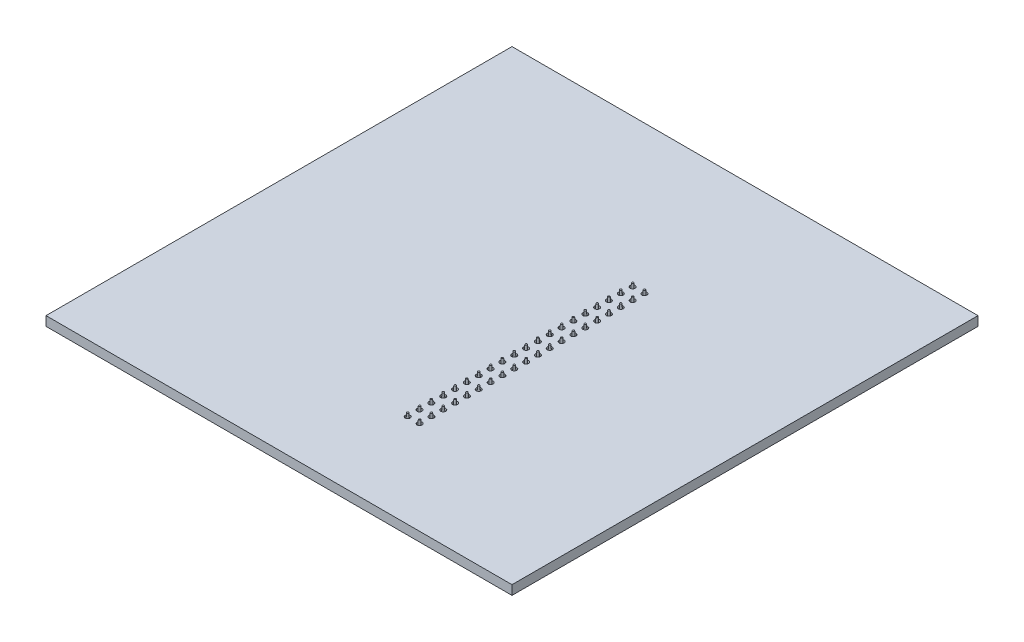
from build123d import *

# Parameters (mm, degrees)
SKETCH1_W              = 100
SKETCH1_H              = 100
BOSS_EXTRUDE1_DEPTH    = 2
SKETCH2_R              = 0.535
CUT_EXTRUDE1_DEPTH     = 71.738956735
SKETCH4_W              = 2.54
SKETCH4_H              = 2.54
SKETCH4_W_2            = 1.54
SKETCH4_H_2            = 1.54
BOSS_EXTRUDE2_DEPTH    = 8.4
LPATTERN2_COUNT        = 20
LPATTERN2_PITCH        = 2.54
LPATTERN2_COUNT_DIR2   = 2
LPATTERN2_PITCH_DIR2   = 2.54
SKETCH5_R              = 0.535
BOSS_EXTRUDE3_DEPTH    = 7.75
BOSS_EXTRUDE3_TAPER    = 2.5
BOSS_EXTRUDE3_2_DEPTH  = 7.75
BOSS_EXTRUDE3_2_TAPER  = 2.5
BOSS_EXTRUDE3_3_DEPTH  = 7.75
BOSS_EXTRUDE3_3_TAPER  = 2.5
BOSS_EXTRUDE3_4_DEPTH  = 7.75
BOSS_EXTRUDE3_4_TAPER  = 2.5
BOSS_EXTRUDE3_5_DEPTH  = 7.75
BOSS_EXTRUDE3_5_TAPER  = 2.5
BOSS_EXTRUDE3_6_DEPTH  = 7.75
BOSS_EXTRUDE3_6_TAPER  = 2.5
BOSS_EXTRUDE3_7_DEPTH  = 7.75
BOSS_EXTRUDE3_7_TAPER  = 2.5
BOSS_EXTRUDE3_8_DEPTH  = 7.75
BOSS_EXTRUDE3_8_TAPER  = 2.5
BOSS_EXTRUDE3_9_DEPTH  = 7.75
BOSS_EXTRUDE3_9_TAPER  = 2.5
BOSS_EXTRUDE3_10_DEPTH = 7.75
BOSS_EXTRUDE3_10_TAPER = 2.5
BOSS_EXTRUDE3_11_DEPTH = 7.75
BOSS_EXTRUDE3_11_TAPER = 2.5
BOSS_EXTRUDE3_12_DEPTH = 7.75
BOSS_EXTRUDE3_12_TAPER = 2.5
BOSS_EXTRUDE3_13_DEPTH = 7.75
BOSS_EXTRUDE3_13_TAPER = 2.5
BOSS_EXTRUDE3_14_DEPTH = 7.75
BOSS_EXTRUDE3_14_TAPER = 2.5
BOSS_EXTRUDE3_15_DEPTH = 7.75
BOSS_EXTRUDE3_15_TAPER = 2.5
BOSS_EXTRUDE3_16_DEPTH = 7.75
BOSS_EXTRUDE3_16_TAPER = 2.5
BOSS_EXTRUDE3_17_DEPTH = 7.75
BOSS_EXTRUDE3_17_TAPER = 2.5
BOSS_EXTRUDE3_18_DEPTH = 7.75
BOSS_EXTRUDE3_18_TAPER = 2.5
BOSS_EXTRUDE3_19_DEPTH = 7.75
BOSS_EXTRUDE3_19_TAPER = 2.5
BOSS_EXTRUDE3_20_DEPTH = 7.75
BOSS_EXTRUDE3_20_TAPER = 2.5
BOSS_EXTRUDE3_21_DEPTH = 7.75
BOSS_EXTRUDE3_21_TAPER = 2.5
BOSS_EXTRUDE3_22_DEPTH = 7.75
BOSS_EXTRUDE3_22_TAPER = 2.5
BOSS_EXTRUDE3_23_DEPTH = 7.75
BOSS_EXTRUDE3_23_TAPER = 2.5
BOSS_EXTRUDE3_24_DEPTH = 7.75
BOSS_EXTRUDE3_24_TAPER = 2.5
BOSS_EXTRUDE3_25_DEPTH = 7.75
BOSS_EXTRUDE3_25_TAPER = 2.5
BOSS_EXTRUDE3_26_DEPTH = 7.75
BOSS_EXTRUDE3_26_TAPER = 2.5
BOSS_EXTRUDE3_27_DEPTH = 7.75
BOSS_EXTRUDE3_27_TAPER = 2.5
BOSS_EXTRUDE3_28_DEPTH = 7.75
BOSS_EXTRUDE3_28_TAPER = 2.5
BOSS_EXTRUDE3_29_DEPTH = 7.75
BOSS_EXTRUDE3_29_TAPER = 2.5
BOSS_EXTRUDE3_30_DEPTH = 7.75
BOSS_EXTRUDE3_30_TAPER = 2.5
BOSS_EXTRUDE3_31_DEPTH = 7.75
BOSS_EXTRUDE3_31_TAPER = 2.5
BOSS_EXTRUDE3_32_DEPTH = 7.75
BOSS_EXTRUDE3_32_TAPER = 2.5
BOSS_EXTRUDE3_33_DEPTH = 7.75
BOSS_EXTRUDE3_33_TAPER = 2.5
BOSS_EXTRUDE3_34_DEPTH = 7.75
BOSS_EXTRUDE3_34_TAPER = 2.5
BOSS_EXTRUDE3_35_DEPTH = 7.75
BOSS_EXTRUDE3_35_TAPER = 2.5
BOSS_EXTRUDE3_36_DEPTH = 7.75
BOSS_EXTRUDE3_36_TAPER = 2.5
BOSS_EXTRUDE3_37_DEPTH = 7.75
BOSS_EXTRUDE3_37_TAPER = 2.5
BOSS_EXTRUDE3_38_DEPTH = 7.75
BOSS_EXTRUDE3_38_TAPER = 2.5
BOSS_EXTRUDE3_39_DEPTH = 7.75
BOSS_EXTRUDE3_39_TAPER = 2.5
BOSS_EXTRUDE3_40_DEPTH = 7.75
BOSS_EXTRUDE3_40_TAPER = 2.5


with BuildPart() as part:
    # Sketch1 → Boss-Extrude1 (new body)
    with BuildSketch(Plane(origin=(0, 0, 0), x_dir=(1, 0, 0), z_dir=(0, 1, 0))):
        Rectangle(SKETCH1_W, SKETCH1_H)
    extrude(amount=BOSS_EXTRUDE1_DEPTH)

    # Sketch2 → Cut-Extrude1 (cut, through all)
    with BuildSketch(Plane(origin=(0, 2, 0), x_dir=(1, 0, 0), z_dir=(0, 1, 0))):
        with Locations((10.138, -29.974)):
            Circle(SKETCH2_R)
        with Locations((7.598, -29.974)):
            Circle(SKETCH2_R)
        with Locations((7.598, -27.434)):
            Circle(SKETCH2_R)
        with Locations((7.598, -24.894)):
            Circle(SKETCH2_R)
        with Locations((7.598, -22.354)):
            Circle(SKETCH2_R)
        with Locations((7.598, -19.814)):
            Circle(SKETCH2_R)
        with Locations((7.598, -17.274)):
            Circle(SKETCH2_R)
        with Locations((7.598, -14.734)):
            Circle(SKETCH2_R)
        with Locations((7.598, -12.194)):
            Circle(SKETCH2_R)
        with Locations((7.598, -9.654)):
            Circle(SKETCH2_R)
        with Locations((7.598, -7.114)):
            Circle(SKETCH2_R)
        with Locations((7.598, -4.574)):
            Circle(SKETCH2_R)
        with Locations((7.598, -2.034)):
            Circle(SKETCH2_R)
        with Locations((7.598, 0.506)):
            Circle(SKETCH2_R)
        with Locations((7.598, 3.046)):
            Circle(SKETCH2_R)
        with Locations((7.598, 5.586)):
            Circle(SKETCH2_R)
        with Locations((7.598, 8.126)):
            Circle(SKETCH2_R)
        with Locations((7.598, 10.666)):
            Circle(SKETCH2_R)
        with Locations((7.598, 13.206)):
            Circle(SKETCH2_R)
        with Locations((7.598, 15.746)):
            Circle(SKETCH2_R)
        with Locations((7.598, 18.286)):
            Circle(SKETCH2_R)
        with Locations((10.138, -27.434)):
            Circle(SKETCH2_R)
        with Locations((10.138, -24.894)):
            Circle(SKETCH2_R)
        with Locations((10.138, -22.354)):
            Circle(SKETCH2_R)
        with Locations((10.138, -19.814)):
            Circle(SKETCH2_R)
        with Locations((10.138, -17.274)):
            Circle(SKETCH2_R)
        with Locations((10.138, -14.734)):
            Circle(SKETCH2_R)
        with Locations((10.138, -12.194)):
            Circle(SKETCH2_R)
        with Locations((10.138, -9.654)):
            Circle(SKETCH2_R)
        with Locations((10.138, -7.114)):
            Circle(SKETCH2_R)
        with Locations((10.138, -4.574)):
            Circle(SKETCH2_R)
        with Locations((10.138, -2.034)):
            Circle(SKETCH2_R)
        with Locations((10.138, 0.506)):
            Circle(SKETCH2_R)
        with Locations((10.138, 3.046)):
            Circle(SKETCH2_R)
        with Locations((10.138, 5.586)):
            Circle(SKETCH2_R)
        with Locations((10.138, 8.126)):
            Circle(SKETCH2_R)
        with Locations((10.138, 10.666)):
            Circle(SKETCH2_R)
        with Locations((10.138, 13.206)):
            Circle(SKETCH2_R)
        with Locations((10.138, 15.746)):
            Circle(SKETCH2_R)
        with Locations((10.138, 18.286)):
            Circle(SKETCH2_R)
    extrude(amount=-CUT_EXTRUDE1_DEPTH, mode=Mode.SUBTRACT)


with BuildPart() as body_2:
    # Sketch4 → Boss-Extrude2 (new body)
    with BuildSketch(Plane(origin=(0, -5, 0), x_dir=(1, 0, 0), z_dir=(0, 1, 0))):
        with Locations((10.138, -29.974)):
            Rectangle(SKETCH4_W, SKETCH4_H)
        with Locations((10.138, -29.974)):
            Rectangle(SKETCH4_W_2, SKETCH4_H_2, mode=Mode.SUBTRACT)
    boss_extrude2 = extrude(amount=-BOSS_EXTRUDE2_DEPTH)

    # LPattern2: Boss-Extrude2 20 × 2
    with Locations(*[(-j * LPATTERN2_PITCH_DIR2, 0, -i * LPATTERN2_PITCH) for i in range(LPATTERN2_COUNT) for j in range(LPATTERN2_COUNT_DIR2) if (i, j) != (0, 0)]):
        add(boss_extrude2)


with BuildPart() as body_3:
    # Sketch5 → Boss-Extrude3 (new body)
    with BuildSketch(Plane(origin=(0, -5, 0), x_dir=(-1, 0, 0), z_dir=(0, -1, 0))):
        with Locations((-7.598, 3.046)):
            Circle(SKETCH5_R)
    extrude(amount=-BOSS_EXTRUDE3_DEPTH, taper=BOSS_EXTRUDE3_TAPER)


with BuildPart() as body_4:
    # Sketch5 → Boss-Extrude3 2 (new body)
    with BuildSketch(Plane(origin=(0, -5, 0), x_dir=(-1, 0, 0), z_dir=(0, -1, 0))):
        with Locations((-7.598, 5.586)):
            Circle(SKETCH5_R)
    extrude(amount=-BOSS_EXTRUDE3_2_DEPTH, taper=BOSS_EXTRUDE3_2_TAPER)


with BuildPart() as body_5:
    # Sketch5 → Boss-Extrude3 3 (new body)
    with BuildSketch(Plane(origin=(0, -5, 0), x_dir=(-1, 0, 0), z_dir=(0, -1, 0))):
        with Locations((-7.598, 8.126)):
            Circle(SKETCH5_R)
    extrude(amount=-BOSS_EXTRUDE3_3_DEPTH, taper=BOSS_EXTRUDE3_3_TAPER)


with BuildPart() as body_6:
    # Sketch5 → Boss-Extrude3 4 (new body)
    with BuildSketch(Plane(origin=(0, -5, 0), x_dir=(-1, 0, 0), z_dir=(0, -1, 0))):
        with Locations((-7.598, 10.666)):
            Circle(SKETCH5_R)
    extrude(amount=-BOSS_EXTRUDE3_4_DEPTH, taper=BOSS_EXTRUDE3_4_TAPER)


with BuildPart() as body_7:
    # Sketch5 → Boss-Extrude3 5 (new body)
    with BuildSketch(Plane(origin=(0, -5, 0), x_dir=(-1, 0, 0), z_dir=(0, -1, 0))):
        with Locations((-7.598, 13.206)):
            Circle(SKETCH5_R)
    extrude(amount=-BOSS_EXTRUDE3_5_DEPTH, taper=BOSS_EXTRUDE3_5_TAPER)


with BuildPart() as body_8:
    # Sketch5 → Boss-Extrude3 6 (new body)
    with BuildSketch(Plane(origin=(0, -5, 0), x_dir=(-1, 0, 0), z_dir=(0, -1, 0))):
        with Locations((-7.598, 15.746)):
            Circle(SKETCH5_R)
    extrude(amount=-BOSS_EXTRUDE3_6_DEPTH, taper=BOSS_EXTRUDE3_6_TAPER)


with BuildPart() as body_9:
    # Sketch5 → Boss-Extrude3 7 (new body)
    with BuildSketch(Plane(origin=(0, -5, 0), x_dir=(-1, 0, 0), z_dir=(0, -1, 0))):
        with Locations((-7.598, 18.286)):
            Circle(SKETCH5_R)
    extrude(amount=-BOSS_EXTRUDE3_7_DEPTH, taper=BOSS_EXTRUDE3_7_TAPER)


with BuildPart() as body_10:
    # Sketch5 → Boss-Extrude3 8 (new body)
    with BuildSketch(Plane(origin=(0, -5, 0), x_dir=(-1, 0, 0), z_dir=(0, -1, 0))):
        with Locations((-10.138, 18.286)):
            Circle(SKETCH5_R)
    extrude(amount=-BOSS_EXTRUDE3_8_DEPTH, taper=BOSS_EXTRUDE3_8_TAPER)


with BuildPart() as body_11:
    # Sketch5 → Boss-Extrude3 9 (new body)
    with BuildSketch(Plane(origin=(0, -5, 0), x_dir=(-1, 0, 0), z_dir=(0, -1, 0))):
        with Locations((-10.138, 15.746)):
            Circle(SKETCH5_R)
    extrude(amount=-BOSS_EXTRUDE3_9_DEPTH, taper=BOSS_EXTRUDE3_9_TAPER)


with BuildPart() as body_12:
    # Sketch5 → Boss-Extrude3 10 (new body)
    with BuildSketch(Plane(origin=(0, -5, 0), x_dir=(-1, 0, 0), z_dir=(0, -1, 0))):
        with Locations((-10.138, 13.206)):
            Circle(SKETCH5_R)
    extrude(amount=-BOSS_EXTRUDE3_10_DEPTH, taper=BOSS_EXTRUDE3_10_TAPER)


with BuildPart() as body_13:
    # Sketch5 → Boss-Extrude3 11 (new body)
    with BuildSketch(Plane(origin=(0, -5, 0), x_dir=(-1, 0, 0), z_dir=(0, -1, 0))):
        with Locations((-10.138, 10.666)):
            Circle(SKETCH5_R)
    extrude(amount=-BOSS_EXTRUDE3_11_DEPTH, taper=BOSS_EXTRUDE3_11_TAPER)


with BuildPart() as body_14:
    # Sketch5 → Boss-Extrude3 12 (new body)
    with BuildSketch(Plane(origin=(0, -5, 0), x_dir=(-1, 0, 0), z_dir=(0, -1, 0))):
        with Locations((-10.138, 8.126)):
            Circle(SKETCH5_R)
    extrude(amount=-BOSS_EXTRUDE3_12_DEPTH, taper=BOSS_EXTRUDE3_12_TAPER)


with BuildPart() as body_15:
    # Sketch5 → Boss-Extrude3 13 (new body)
    with BuildSketch(Plane(origin=(0, -5, 0), x_dir=(-1, 0, 0), z_dir=(0, -1, 0))):
        with Locations((-10.138, 5.586)):
            Circle(SKETCH5_R)
    extrude(amount=-BOSS_EXTRUDE3_13_DEPTH, taper=BOSS_EXTRUDE3_13_TAPER)


with BuildPart() as body_16:
    # Sketch5 → Boss-Extrude3 14 (new body)
    with BuildSketch(Plane(origin=(0, -5, 0), x_dir=(-1, 0, 0), z_dir=(0, -1, 0))):
        with Locations((-10.138, 3.046)):
            Circle(SKETCH5_R)
    extrude(amount=-BOSS_EXTRUDE3_14_DEPTH, taper=BOSS_EXTRUDE3_14_TAPER)


with BuildPart() as body_17:
    # Sketch5 → Boss-Extrude3 15 (new body)
    with BuildSketch(Plane(origin=(0, -5, 0), x_dir=(-1, 0, 0), z_dir=(0, -1, 0))):
        with Locations((-7.598, 0.506)):
            Circle(SKETCH5_R)
    extrude(amount=-BOSS_EXTRUDE3_15_DEPTH, taper=BOSS_EXTRUDE3_15_TAPER)


with BuildPart() as body_18:
    # Sketch5 → Boss-Extrude3 16 (new body)
    with BuildSketch(Plane(origin=(0, -5, 0), x_dir=(-1, 0, 0), z_dir=(0, -1, 0))):
        with Locations((-10.138, 0.506)):
            Circle(SKETCH5_R)
    extrude(amount=-BOSS_EXTRUDE3_16_DEPTH, taper=BOSS_EXTRUDE3_16_TAPER)


with BuildPart() as body_19:
    # Sketch5 → Boss-Extrude3 17 (new body)
    with BuildSketch(Plane(origin=(0, -5, 0), x_dir=(-1, 0, 0), z_dir=(0, -1, 0))):
        with Locations((-10.138, -2.034)):
            Circle(SKETCH5_R)
    extrude(amount=-BOSS_EXTRUDE3_17_DEPTH, taper=BOSS_EXTRUDE3_17_TAPER)


with BuildPart() as body_20:
    # Sketch5 → Boss-Extrude3 18 (new body)
    with BuildSketch(Plane(origin=(0, -5, 0), x_dir=(-1, 0, 0), z_dir=(0, -1, 0))):
        with Locations((-7.598, -2.034)):
            Circle(SKETCH5_R)
    extrude(amount=-BOSS_EXTRUDE3_18_DEPTH, taper=BOSS_EXTRUDE3_18_TAPER)


with BuildPart() as body_21:
    # Sketch5 → Boss-Extrude3 19 (new body)
    with BuildSketch(Plane(origin=(0, -5, 0), x_dir=(-1, 0, 0), z_dir=(0, -1, 0))):
        with Locations((-7.598, -4.574)):
            Circle(SKETCH5_R)
    extrude(amount=-BOSS_EXTRUDE3_19_DEPTH, taper=BOSS_EXTRUDE3_19_TAPER)


with BuildPart() as body_22:
    # Sketch5 → Boss-Extrude3 20 (new body)
    with BuildSketch(Plane(origin=(0, -5, 0), x_dir=(-1, 0, 0), z_dir=(0, -1, 0))):
        with Locations((-10.138, -4.574)):
            Circle(SKETCH5_R)
    extrude(amount=-BOSS_EXTRUDE3_20_DEPTH, taper=BOSS_EXTRUDE3_20_TAPER)


with BuildPart() as body_23:
    # Sketch5 → Boss-Extrude3 21 (new body)
    with BuildSketch(Plane(origin=(0, -5, 0), x_dir=(-1, 0, 0), z_dir=(0, -1, 0))):
        with Locations((-10.138, -7.114)):
            Circle(SKETCH5_R)
    extrude(amount=-BOSS_EXTRUDE3_21_DEPTH, taper=BOSS_EXTRUDE3_21_TAPER)


with BuildPart() as body_24:
    # Sketch5 → Boss-Extrude3 22 (new body)
    with BuildSketch(Plane(origin=(0, -5, 0), x_dir=(-1, 0, 0), z_dir=(0, -1, 0))):
        with Locations((-7.598, -7.114)):
            Circle(SKETCH5_R)
    extrude(amount=-BOSS_EXTRUDE3_22_DEPTH, taper=BOSS_EXTRUDE3_22_TAPER)


with BuildPart() as body_25:
    # Sketch5 → Boss-Extrude3 23 (new body)
    with BuildSketch(Plane(origin=(0, -5, 0), x_dir=(-1, 0, 0), z_dir=(0, -1, 0))):
        with Locations((-7.598, -9.654)):
            Circle(SKETCH5_R)
    extrude(amount=-BOSS_EXTRUDE3_23_DEPTH, taper=BOSS_EXTRUDE3_23_TAPER)


with BuildPart() as body_26:
    # Sketch5 → Boss-Extrude3 24 (new body)
    with BuildSketch(Plane(origin=(0, -5, 0), x_dir=(-1, 0, 0), z_dir=(0, -1, 0))):
        with Locations((-10.138, -9.654)):
            Circle(SKETCH5_R)
    extrude(amount=-BOSS_EXTRUDE3_24_DEPTH, taper=BOSS_EXTRUDE3_24_TAPER)


with BuildPart() as body_27:
    # Sketch5 → Boss-Extrude3 25 (new body)
    with BuildSketch(Plane(origin=(0, -5, 0), x_dir=(-1, 0, 0), z_dir=(0, -1, 0))):
        with Locations((-7.598, -12.194)):
            Circle(SKETCH5_R)
    extrude(amount=-BOSS_EXTRUDE3_25_DEPTH, taper=BOSS_EXTRUDE3_25_TAPER)


with BuildPart() as body_28:
    # Sketch5 → Boss-Extrude3 26 (new body)
    with BuildSketch(Plane(origin=(0, -5, 0), x_dir=(-1, 0, 0), z_dir=(0, -1, 0))):
        with Locations((-10.138, -12.194)):
            Circle(SKETCH5_R)
    extrude(amount=-BOSS_EXTRUDE3_26_DEPTH, taper=BOSS_EXTRUDE3_26_TAPER)


with BuildPart() as body_29:
    # Sketch5 → Boss-Extrude3 27 (new body)
    with BuildSketch(Plane(origin=(0, -5, 0), x_dir=(-1, 0, 0), z_dir=(0, -1, 0))):
        with Locations((-10.138, -14.734)):
            Circle(SKETCH5_R)
    extrude(amount=-BOSS_EXTRUDE3_27_DEPTH, taper=BOSS_EXTRUDE3_27_TAPER)


with BuildPart() as body_30:
    # Sketch5 → Boss-Extrude3 28 (new body)
    with BuildSketch(Plane(origin=(0, -5, 0), x_dir=(-1, 0, 0), z_dir=(0, -1, 0))):
        with Locations((-7.598, -14.734)):
            Circle(SKETCH5_R)
    extrude(amount=-BOSS_EXTRUDE3_28_DEPTH, taper=BOSS_EXTRUDE3_28_TAPER)


with BuildPart() as body_31:
    # Sketch5 → Boss-Extrude3 29 (new body)
    with BuildSketch(Plane(origin=(0, -5, 0), x_dir=(-1, 0, 0), z_dir=(0, -1, 0))):
        with Locations((-7.598, -17.274)):
            Circle(SKETCH5_R)
    extrude(amount=-BOSS_EXTRUDE3_29_DEPTH, taper=BOSS_EXTRUDE3_29_TAPER)


with BuildPart() as body_32:
    # Sketch5 → Boss-Extrude3 30 (new body)
    with BuildSketch(Plane(origin=(0, -5, 0), x_dir=(-1, 0, 0), z_dir=(0, -1, 0))):
        with Locations((-10.138, -17.274)):
            Circle(SKETCH5_R)
    extrude(amount=-BOSS_EXTRUDE3_30_DEPTH, taper=BOSS_EXTRUDE3_30_TAPER)


with BuildPart() as body_33:
    # Sketch5 → Boss-Extrude3 31 (new body)
    with BuildSketch(Plane(origin=(0, -5, 0), x_dir=(-1, 0, 0), z_dir=(0, -1, 0))):
        with Locations((-10.138, -19.814)):
            Circle(SKETCH5_R)
    extrude(amount=-BOSS_EXTRUDE3_31_DEPTH, taper=BOSS_EXTRUDE3_31_TAPER)


with BuildPart() as body_34:
    # Sketch5 → Boss-Extrude3 32 (new body)
    with BuildSketch(Plane(origin=(0, -5, 0), x_dir=(-1, 0, 0), z_dir=(0, -1, 0))):
        with Locations((-7.598, -19.814)):
            Circle(SKETCH5_R)
    extrude(amount=-BOSS_EXTRUDE3_32_DEPTH, taper=BOSS_EXTRUDE3_32_TAPER)


with BuildPart() as body_35:
    # Sketch5 → Boss-Extrude3 33 (new body)
    with BuildSketch(Plane(origin=(0, -5, 0), x_dir=(-1, 0, 0), z_dir=(0, -1, 0))):
        with Locations((-7.598, -22.354)):
            Circle(SKETCH5_R)
    extrude(amount=-BOSS_EXTRUDE3_33_DEPTH, taper=BOSS_EXTRUDE3_33_TAPER)


with BuildPart() as body_36:
    # Sketch5 → Boss-Extrude3 34 (new body)
    with BuildSketch(Plane(origin=(0, -5, 0), x_dir=(-1, 0, 0), z_dir=(0, -1, 0))):
        with Locations((-10.138, -22.354)):
            Circle(SKETCH5_R)
    extrude(amount=-BOSS_EXTRUDE3_34_DEPTH, taper=BOSS_EXTRUDE3_34_TAPER)


with BuildPart() as body_37:
    # Sketch5 → Boss-Extrude3 35 (new body)
    with BuildSketch(Plane(origin=(0, -5, 0), x_dir=(-1, 0, 0), z_dir=(0, -1, 0))):
        with Locations((-7.598, -24.894)):
            Circle(SKETCH5_R)
    extrude(amount=-BOSS_EXTRUDE3_35_DEPTH, taper=BOSS_EXTRUDE3_35_TAPER)


with BuildPart() as body_38:
    # Sketch5 → Boss-Extrude3 36 (new body)
    with BuildSketch(Plane(origin=(0, -5, 0), x_dir=(-1, 0, 0), z_dir=(0, -1, 0))):
        with Locations((-10.138, -24.894)):
            Circle(SKETCH5_R)
    extrude(amount=-BOSS_EXTRUDE3_36_DEPTH, taper=BOSS_EXTRUDE3_36_TAPER)


with BuildPart() as body_39:
    # Sketch5 → Boss-Extrude3 37 (new body)
    with BuildSketch(Plane(origin=(0, -5, 0), x_dir=(-1, 0, 0), z_dir=(0, -1, 0))):
        with Locations((-7.598, -27.434)):
            Circle(SKETCH5_R)
    extrude(amount=-BOSS_EXTRUDE3_37_DEPTH, taper=BOSS_EXTRUDE3_37_TAPER)


with BuildPart() as body_40:
    # Sketch5 → Boss-Extrude3 38 (new body)
    with BuildSketch(Plane(origin=(0, -5, 0), x_dir=(-1, 0, 0), z_dir=(0, -1, 0))):
        with Locations((-10.138, -27.434)):
            Circle(SKETCH5_R)
    extrude(amount=-BOSS_EXTRUDE3_38_DEPTH, taper=BOSS_EXTRUDE3_38_TAPER)


with BuildPart() as body_41:
    # Sketch5 → Boss-Extrude3 39 (new body)
    with BuildSketch(Plane(origin=(0, -5, 0), x_dir=(-1, 0, 0), z_dir=(0, -1, 0))):
        with Locations((-10.138, -29.974)):
            Circle(SKETCH5_R)
    extrude(amount=-BOSS_EXTRUDE3_39_DEPTH, taper=BOSS_EXTRUDE3_39_TAPER)


with BuildPart() as body_42:
    # Sketch5 → Boss-Extrude3 40 (new body)
    with BuildSketch(Plane(origin=(0, -5, 0), x_dir=(-1, 0, 0), z_dir=(0, -1, 0))):
        with Locations((-7.598, -29.974)):
            Circle(SKETCH5_R)
    extrude(amount=-BOSS_EXTRUDE3_40_DEPTH, taper=BOSS_EXTRUDE3_40_TAPER)


solid = Compound([part.part, body_2.part, body_3.part, body_4.part, body_5.part, body_6.part, body_7.part, body_8.part, body_9.part, body_10.part, body_11.part, body_12.part, body_13.part, body_14.part, body_15.part, body_16.part, body_17.part, body_18.part, body_19.part, body_20.part, body_21.part, body_22.part, body_23.part, body_24.part, body_25.part, body_26.part, body_27.part, body_28.part, body_29.part, body_30.part, body_31.part, body_32.part, body_33.part, body_34.part, body_35.part, body_36.part, body_37.part, body_38.part, body_39.part, body_40.part, body_41.part, body_42.part])
